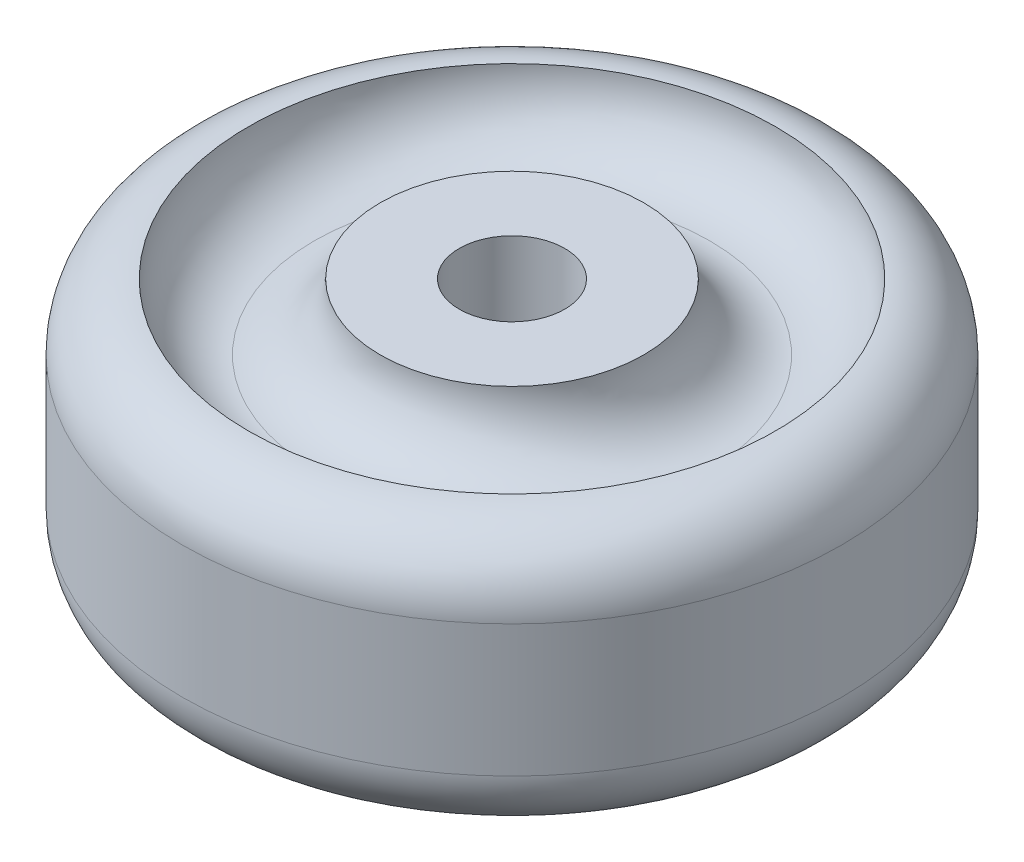
from build123d import *

# Parameters (mm, degrees)
SZKIC1_R                    = 25
DODANIE_WYCI_GNI_CIE1_DEPTH = 10
SZKIC2_R                    = 20
SZKIC2_R_2                  = 10
WYTNIJ_WYCI_GNI_CIE1_DEPTH  = 5
ZAOKR_GLENIE1_R             = 5
SZKIC3_R                    = 4
WYTNIJ_WYCI_GNI_CIE2_DEPTH  = 37.742346142
ZAOKR_GLENIE2_R             = 5
ZAOKR_GLENIE1_OF_LUSTRO1_R  = 5
ZAOKR_GLENIE2_OF_LUSTRO1_R  = 5


with BuildPart() as part:
    # Szkic1 → Dodanie-wyciągnięcie1 (new body)
    with BuildSketch(Plane(origin=(0, 0, 0), x_dir=(1, 0, 0), z_dir=(0, 1, 0))):
        with Locations(Location((0, 0, 0), (0, 0, 270))):
            Circle(SZKIC1_R)
    dodanie_wyci_gni_cie1 = extrude(amount=DODANIE_WYCI_GNI_CIE1_DEPTH)

    # Szkic2 → Wytnij-wyciągnięcie1 (cut)
    with BuildSketch(Plane(origin=(0, 10, 0), x_dir=(1, 0, 0), z_dir=(0, 1, 0))):
        with Locations(Location((0, 0, 0), (0, 0, 270))):
            Circle(SZKIC2_R)
        with Locations(Location((0, 0, 0), (0, 0, 270))):
            Circle(SZKIC2_R_2, mode=Mode.SUBTRACT)
    wytnij_wyci_gni_cie1 = extrude(amount=-WYTNIJ_WYCI_GNI_CIE1_DEPTH, mode=Mode.SUBTRACT)

    # Zaokrąglenie1
    zaokr_glenie1_edges = [part.edges().sort_by_distance(p)[0] for p in [
        (0, 5, -20),
        (0, 5, -10),
    ]]
    fillet(zaokr_glenie1_edges, radius=ZAOKR_GLENIE1_R - 0.0001)  # a hair under: the kernel refuses the full size

    # Szkic3 → Wytnij-wyciągnięcie2 (cut, symmetric)
    with BuildSketch(Plane(origin=(0, 10, 0), x_dir=(1, 0, 0), z_dir=(0, 1, 0))):
        with Locations(Location((0, 0, 0), (0, 0, 270))):
            Circle(SZKIC3_R)
    wytnij_wyci_gni_cie2 = extrude(amount=WYTNIJ_WYCI_GNI_CIE2_DEPTH, both=True, mode=Mode.SUBTRACT)

    # Zaokrąglenie2
    zaokr_glenie2_edges = [part.edges().sort_by_distance(p)[0] for p in [
        (0, 10, -25),
    ]]
    fillet(zaokr_glenie2_edges, radius=ZAOKR_GLENIE2_R - 0.0001)  # a hair under: the kernel refuses the full size

    # Lustro1: Dodanie-wyciągnięcie1, Wytnij-wyciągnięcie1, Wytnij-wyciągnięcie2 across plane
    add(dodanie_wyci_gni_cie1.mirror(Plane.ZX))
    add(wytnij_wyci_gni_cie1.mirror(Plane.ZX), mode=Mode.SUBTRACT)
    add(wytnij_wyci_gni_cie2.mirror(Plane.ZX), mode=Mode.SUBTRACT)

    # Zaokrąglenie1 of Lustro1
    zaokr_glenie1_of_lustro1_edges = [part.edges().sort_by_distance(p)[0] for p in [
        (0, -5, -20),
        (0, -5, -10),
    ]]
    fillet(zaokr_glenie1_of_lustro1_edges, radius=ZAOKR_GLENIE1_OF_LUSTRO1_R - 0.0001)  # a hair under: the kernel refuses the full size

    # Zaokrąglenie2 of Lustro1
    zaokr_glenie2_of_lustro1_edges = [part.edges().sort_by_distance(p)[0] for p in [
        (0, -10, -25),
    ]]
    fillet(zaokr_glenie2_of_lustro1_edges, radius=ZAOKR_GLENIE2_OF_LUSTRO1_R - 0.0001)  # a hair under: the kernel refuses the full size


solid = part.part
